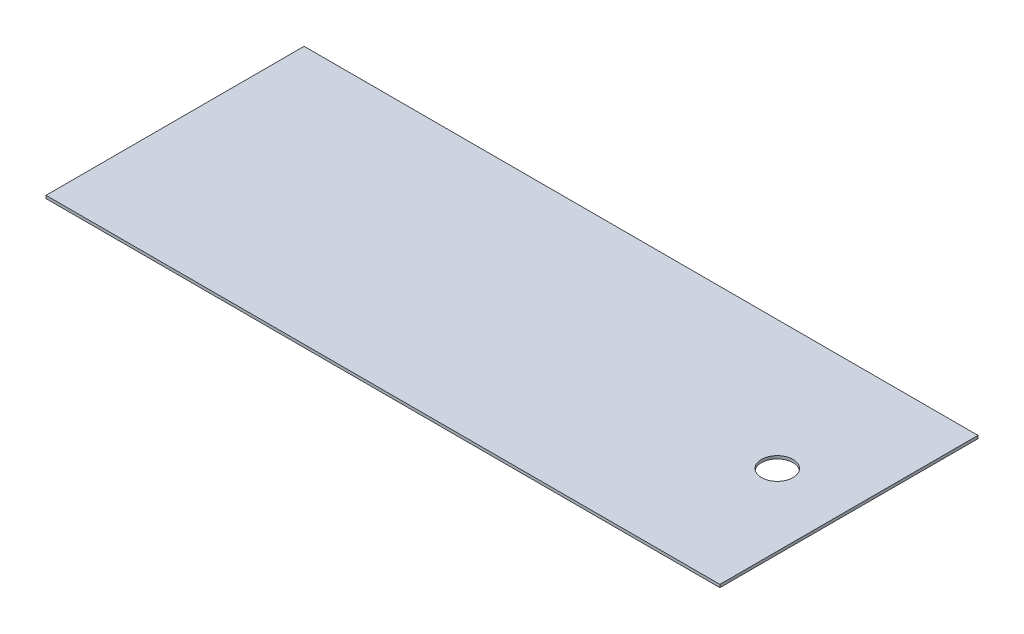
from build123d import *

# Parameters (mm, degrees)
SKETCH1_W          = 470
SKETCH1_H          = 180
BASE_FLANGE1_DEPTH = 2
SKETCH10_R         = 11
EXTRUDE1_DEPTH     = 10


# Sheet-metal steps are written as plain solids
with BuildPart() as part:
    # Sketch1 → Base-Flange1 (new body)
    with BuildSketch(Plane(origin=(0, 0, 0), x_dir=(1, 0, 0), z_dir=(0, 1, 0))):
        Rectangle(SKETCH1_W, SKETCH1_H)
    extrude(amount=-BASE_FLANGE1_DEPTH)

    # Sketch10 → Extrude1 (cut)
    with BuildSketch(Plane(origin=(0, 0, 0), x_dir=(1, 0, 0), z_dir=(0, 1, 0))):
        with Locations(Location((185, 0, 0), (0, 0, 270))):
            Circle(SKETCH10_R)
    extrude(amount=-EXTRUDE1_DEPTH, mode=Mode.SUBTRACT)


solid = part.part
